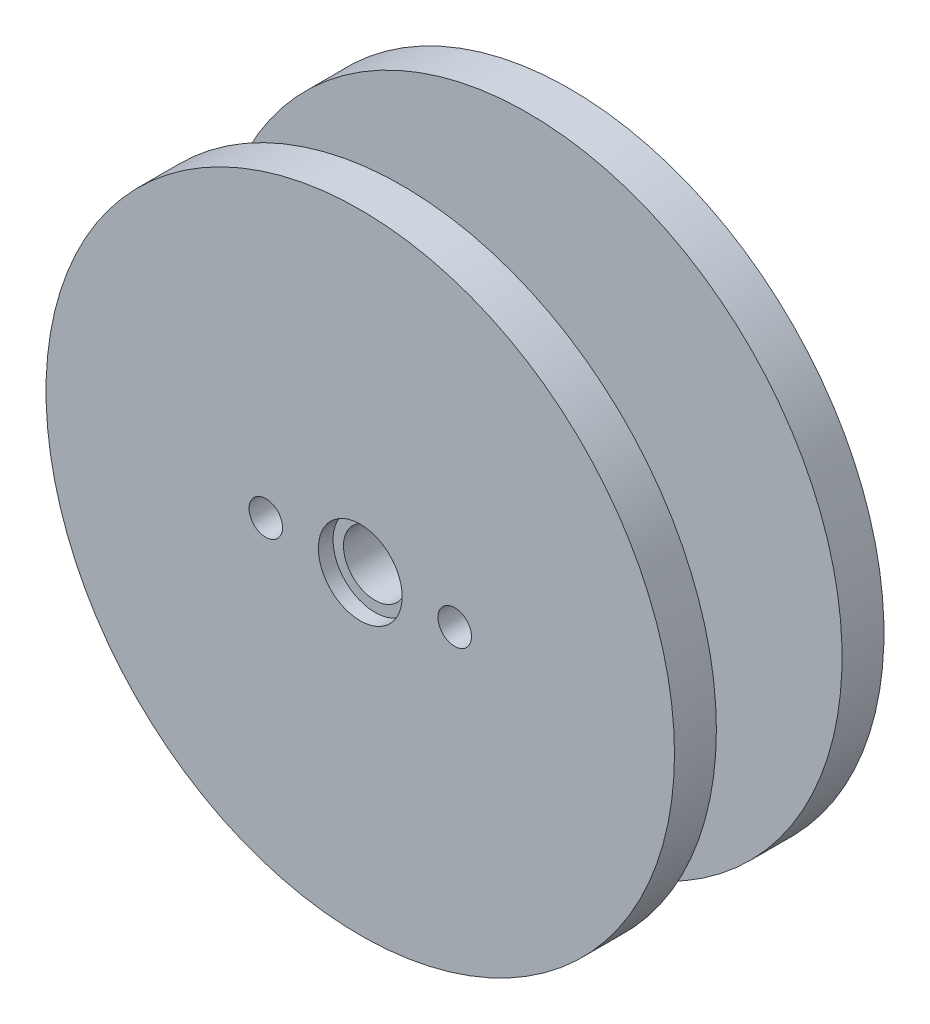
from build123d import *

# Parameters (mm, degrees)
SKETCH1_R           = 2.5
BOSS_EXTRUDE1_DEPTH = 6
SKETCH2_R           = 15
BOSS_EXTRUDE2_DEPTH = 2
BOSS_EXTRUDE3_START = 2
SKETCH3_R           = 15
BOSS_EXTRUDE3_DEPTH = 2
FILLET9_R           = 3
FILLET10_R          = 3
SKETCH4_R           = 1.5
CUT_EXTRUDE1_DEPTH  = 10
SKETCH5_R           = 1.999371682
CUT_EXTRUDE2_DEPTH  = 0.7
SKETCH7_R           = 0.8
CUT_EXTRUDE6_DEPTH  = 3


with BuildPart() as part:
    # Sketch1 → Boss-Extrude1 (new body)
    with BuildSketch(Plane.XY):
        Circle(SKETCH1_R)
    extrude(amount=BOSS_EXTRUDE1_DEPTH)

    # Sketch2 → Boss-Extrude2 (add)
    with BuildSketch(Plane(origin=(0, 0, 0), x_dir=(-1, 0, 0), z_dir=(0, 0, -1))):
        Circle(SKETCH2_R)
    extrude(amount=BOSS_EXTRUDE2_DEPTH)

    # Sketch3 → Boss-Extrude3 (add)
    with BuildSketch(Plane.XY.offset(6).offset(BOSS_EXTRUDE3_START)):
        with Locations(Location((0, 0, 0), (0, 0, 180))):
            Circle(SKETCH3_R)
    extrude(amount=-BOSS_EXTRUDE3_DEPTH)

    # Fillet9
    fillet9_edges = [part.edges().sort_by_distance(p)[0] for p in [
        (-2.5, 0, 0),
    ]]
    fillet(fillet9_edges, radius=FILLET9_R)

    # Fillet10
    fillet10_edges = [part.edges().sort_by_distance(p)[0] for p in [
        (-2.5, 0, 6),
    ]]
    fillet(fillet10_edges, radius=FILLET10_R - 0.0001)  # a hair under: the kernel refuses the full size

    # Sketch4 → Cut-Extrude1 (cut)
    with BuildSketch(Plane(origin=(0, 0, -2), x_dir=(-1, 0, 0), z_dir=(0, 0, -1))):
        Circle(SKETCH4_R)
    extrude(amount=-CUT_EXTRUDE1_DEPTH, mode=Mode.SUBTRACT)

    # Sketch5 → Cut-Extrude2 (cut)
    with BuildSketch(Plane.XY.offset(8)):
        Circle(SKETCH5_R)
    extrude(amount=-CUT_EXTRUDE2_DEPTH, mode=Mode.SUBTRACT)

    # Sketch7 → Cut-Extrude6 (cut)
    with BuildSketch(Plane.XY.offset(8)):
        with Locations((4.509371682, 0)):
            Circle(SKETCH7_R)
        with Locations((-4.509371682, 0)):
            Circle(SKETCH7_R)
    extrude(amount=-CUT_EXTRUDE6_DEPTH, mode=Mode.SUBTRACT)


solid = part.part
